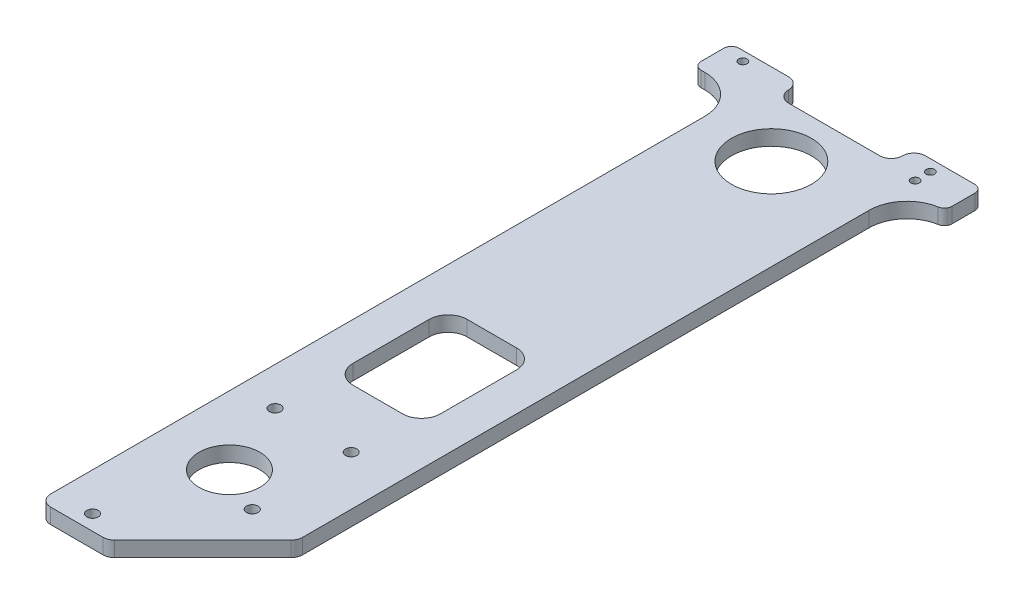
from build123d import *

# Parameters (mm, degrees)
SKETCH_1_R          = 1.5
SKETCH_1_R_2        = 8
SKETCH_1_R_3        = 1.1
SKETCH_1_R_4        = 10.5
EXTRUDE_1_DEPTH     = 4
SKETCH_3_W          = 30
SKETCH_3_H          = 6
CUT_EXTRUDE_1_DEPTH = 5
FILLET_4_R          = 3
CHAMFER_1_SIZE      = 25
FILLET_8_R          = 5
FILLET_12_R         = 2
FILLET_13_R         = 3
FILLET_14_R         = 10


with BuildPart() as part:
    # 草图1 → 凸台-拉伸1 (new body)
    with BuildSketch(Plane(origin=(0, 0, 0), x_dir=(1, 0, 0), z_dir=(0, 1, 0))):
        Polygon((-20, 17.5), (-20, -97.5), (23, -97.5), (23, 17.5), (23, 87.5), (33, 87.5), (33, 97.5), (-33, 97.5), (-33, 87.5), (-20, 87.5), align=None)
        with Locations(Location((-10, -93.5, 0), (0, 0, 270))):
            Circle(SKETCH_1_R, mode=Mode.SUBTRACT)
        with Locations(Location((-2, -65.5, 0), (0, 0, 270))):
            Circle(SKETCH_1_R_2, mode=Mode.SUBTRACT)
        with Locations(Location((-10, -45.5, 0), (0, 0, 270))):
            Circle(SKETCH_1_R, mode=Mode.SUBTRACT)
        with Locations(Location((10, -71.5, 0), (0, 0, 270))):
            Circle(SKETCH_1_R, mode=Mode.SUBTRACT)
        with Locations(Location((10, -45.5, 0), (0, 0, 270))):
            Circle(SKETCH_1_R, mode=Mode.SUBTRACT)
        Polygon((-10, 0), (10, 0), (13, 0), (13, -30), (10, -30), (-10, -30), align=None, mode=Mode.SUBTRACT)
        with Locations(Location((-27.5, 95, 0), (0, 0, 270))):
            Circle(SKETCH_1_R_3, mode=Mode.SUBTRACT)
        with Locations(Location((-1, 76, 0), (0, 0, 270))):
            Circle(SKETCH_1_R_4, mode=Mode.SUBTRACT)
        with Locations(Location((22.3, 90.5, 0), (0, 0, 270))):
            Circle(SKETCH_1_R_3, mode=Mode.SUBTRACT)
        with Locations(Location((22.3, 94.5, 0), (0, 0, 270))):
            Circle(SKETCH_1_R_3, mode=Mode.SUBTRACT)
    extrude(amount=EXTRUDE_1_DEPTH)

    # 草图3 → 切除-拉伸1 (cut)
    with BuildSketch(Plane(origin=(0, 4, 0), x_dir=(1, 0, 0), z_dir=(0, 1, 0))):
        with Locations((0, 94.5)):
            Rectangle(SKETCH_3_W, SKETCH_3_H)
    extrude(amount=-CUT_EXTRUDE_1_DEPTH, mode=Mode.SUBTRACT)

    # 圆角4
    fillet_4_edges = [part.edges().sort_by_distance(p)[0] for p in [
        (15, 2, -91.5),
        (-15, 2, -91.5),
    ]]
    fillet(fillet_4_edges, radius=FILLET_4_R)
    fillet_4_2_edges = [part.edges().sort_by_distance(p)[0] for p in [
        (15, 2, -97.5),
        (-15, 2, -97.5),
    ]]
    fillet(fillet_4_2_edges, radius=FILLET_4_R - 0.0001)  # a hair under: the kernel refuses the full size

    # 倒角1
    chamfer_1_edges = [part.edges().sort_by_distance(p)[0] for p in [
        (23, 2, 97.5),
    ]]
    chamfer(chamfer_1_edges, length=CHAMFER_1_SIZE)

    # 圆角8
    fillet_8_edges = [part.edges().sort_by_distance(p)[0] for p in [
        (13, 2, 0),
        (-10, 2, 0),
        (-10, 2, 30),
        (13, 2, 30),
    ]]
    fillet(fillet_8_edges, radius=FILLET_8_R)

    # 圆角12
    fillet_12_edges = [part.edges().sort_by_distance(p)[0] for p in [
        (-33, 2, -87.5),
        (-33, 2, -97.5),
        (33, 2, -97.5),
        (33, 2, -87.5),
    ]]
    fillet(fillet_12_edges, radius=FILLET_12_R)

    # 圆角13
    fillet_13_edges = [part.edges().sort_by_distance(p)[0] for p in [
        (23, 2, 72.5),
        (-2, 2, 97.5),
        (-20, 2, 97.5),
    ]]
    fillet(fillet_13_edges, radius=FILLET_13_R)

    # 圆角14
    fillet_14_edges = [part.edges().sort_by_distance(p)[0] for p in [
        (23, 2, -87.5),
        (-20, 2, -87.5),
    ]]
    fillet(fillet_14_edges, radius=FILLET_14_R)


solid = part.part
